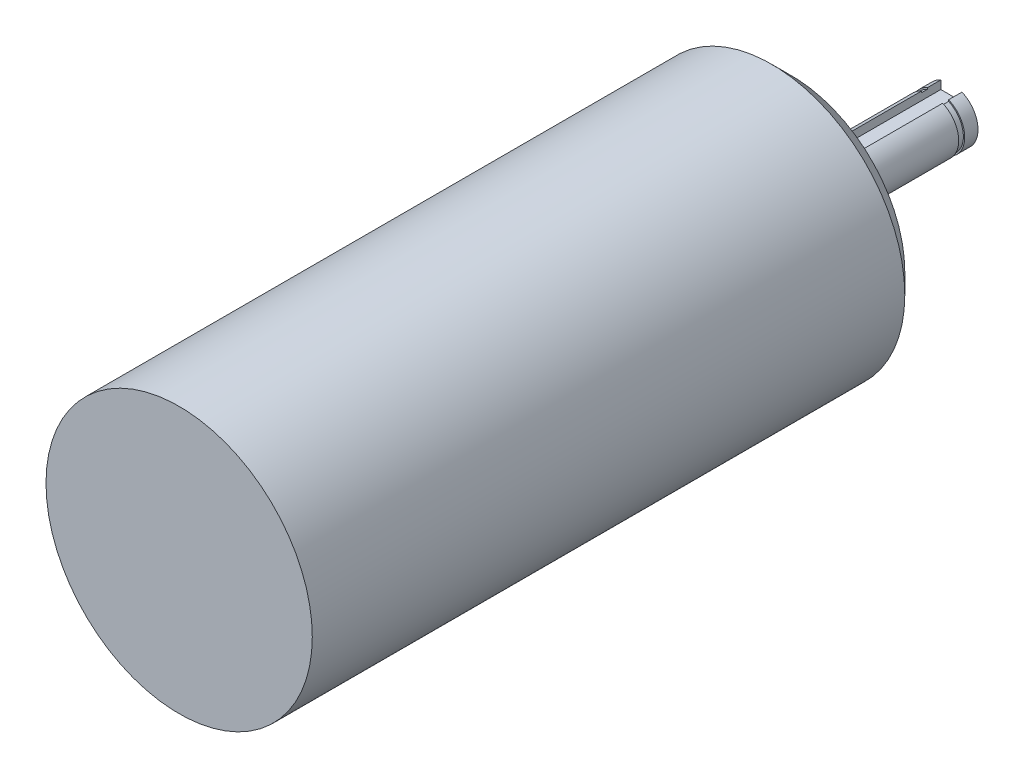
from build123d import *

# Parameters (mm, degrees)
SKETCH1_R                       = 20
BOSS_EXTRUDE1_DEPTH             = 92
M4X0_7_TAPPED_HOLE1_D           = 3.3
M4X0_7_TAPPED_HOLE1_DEPTH       = 4
M4X0_7_TAPPED_HOLE1_CSINK_D     = 4.05
M4X0_7_TAPPED_HOLE1_CSINK_ANGLE = 90
M4X0_7_TAPPED_HOLE1_TIP         = 0.991420021
SKETCH6_R                       = 4
BOSS_EXTRUDE2_DEPTH             = 24
CHAMFER1_SIZE                   = 3
SKETCH7_W                       = 3.175
SKETCH7_H                       = 3.175
CUT_EXTRUDE1_DEPTH              = 19
CUT_EXTRUDE2_START              = -0.9
SKETCH8_R                       = 4
SKETCH8_R_2                     = 3.8
CUT_EXTRUDE2_DEPTH              = 0.9


with BuildPart() as part:
    # Sketch1 → Boss-Extrude1 (new body)
    with BuildSketch(Plane.XY):
        Circle(SKETCH1_R)
    extrude(amount=BOSS_EXTRUDE1_DEPTH)

    # M4x0.7 Tapped Hole1
    with Locations(Plane(origin=(0, 0, 0), x_dir=(-1, 0, 0), z_dir=(0, 0, -1))):
        with Locations((0, 12.5), (-12.5, 0), (0, -12.5), (12.5, 0)):
            CounterSinkHole(M4X0_7_TAPPED_HOLE1_D / 2, M4X0_7_TAPPED_HOLE1_CSINK_D / 2, depth=M4X0_7_TAPPED_HOLE1_DEPTH, counter_sink_angle=M4X0_7_TAPPED_HOLE1_CSINK_ANGLE)
            with Locations((0, 0, -(M4X0_7_TAPPED_HOLE1_DEPTH + M4X0_7_TAPPED_HOLE1_TIP / 2))):  # 118° drill point
                Cone(0, M4X0_7_TAPPED_HOLE1_D / 2, M4X0_7_TAPPED_HOLE1_TIP, mode=Mode.SUBTRACT)

    # Sketch6 → Boss-Extrude2 (add)
    with BuildSketch(Plane(origin=(0, 0, 0), x_dir=(-1, 0, 0), z_dir=(0, 0, -1))):
        Circle(SKETCH6_R)
    extrude(amount=BOSS_EXTRUDE2_DEPTH)

    # Chamfer1
    chamfer1_edges = [part.edges().sort_by_distance(p)[0] for p in [
        (-20, 0, 0),
    ]]
    chamfer(chamfer1_edges, length=CHAMFER1_SIZE)

    # Sketch7 → Cut-Extrude1 (cut)
    with BuildSketch(Plane(origin=(0, 0, -24), x_dir=(-1, 0, 0), z_dir=(0, 0, -1))):
        with Locations((0, 4)):
            Rectangle(SKETCH7_W, SKETCH7_H)
    extrude(amount=-CUT_EXTRUDE1_DEPTH, mode=Mode.SUBTRACT)

    # Sketch8 → Cut-Extrude2 (cut)
    with BuildSketch(Plane(origin=(0, 0, -22), x_dir=(-1, 0, 0), z_dir=(0, 0, -1)).offset(CUT_EXTRUDE2_START)):
        Circle(SKETCH8_R)
        Circle(SKETCH8_R_2, mode=Mode.SUBTRACT)
    extrude(amount=CUT_EXTRUDE2_DEPTH, mode=Mode.SUBTRACT)


solid = part.part
